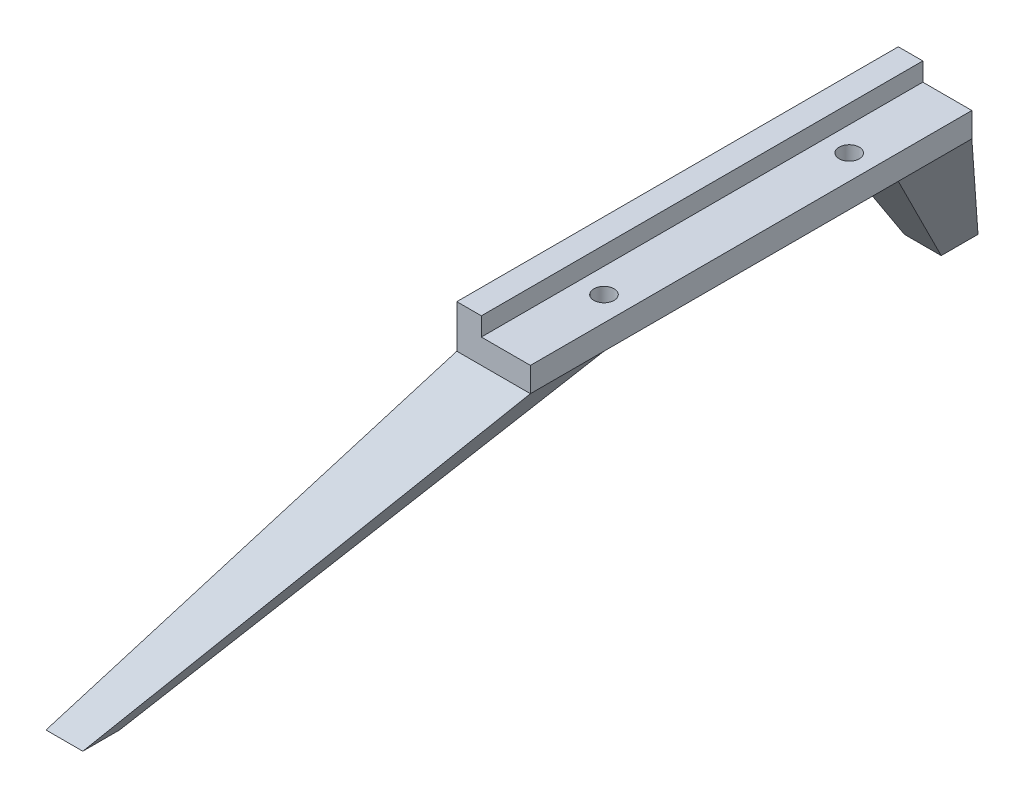
from build123d import *

# Parameters (mm, degrees)
EXTRUDE_1_DEPTH     = 36
SKETCH_2_R          = 1.65
CUT_EXTRUDE_1_DEPTH = 38.094473982


with BuildPart() as part:
    # 草图1 → 凸台-拉伸1 (new, symmetric)
    with BuildSketch(Plane.XY):
        Polygon((0, 0), (0, 3), (-4, 3), (-4, -4), (8, -4), (8, 0), align=None)
    extrude(amount=EXTRUDE_1_DEPTH, both=True)

    # 草图2 → 切除-拉伸1 (cut, through all)
    with BuildSketch(Plane(origin=(0, 0, 0), x_dir=(1, 0, 0), z_dir=(0, 1, 0))):
        with Locations(Location((4, 20, 0), (0, 0, 270))):
            Circle(SKETCH_2_R)
        with Locations(Location((4, -20, 0), (0, 0, 90))):
            Circle(SKETCH_2_R)
    extrude(amount=-CUT_EXTRUDE_1_DEPTH, mode=Mode.SUBTRACT)

    # 边界1: read off the stored shape, not the designer's step
    # 边界1: loft between two sections, ruled curve by curve
    other_1_from = [
        Edge.make_line((-34, -54, -73), (-34, -54, -67)),
        Edge.make_line((-34, -54, -67), (-28, -54, -67)),
        Edge.make_line((-28, -54, -67), (-28, -54, -73)),
        Edge.make_line((-28, -54, -73), (-34, -54, -73)),
    ]
    other_1_to = [
        Edge.make_line((-4, -4, -36), (-4, -4, -24)),
        Edge.make_line((-4, -4, -24), (8, -4, -24)),
        Edge.make_line((8, -4, -24), (8, -4, -36)),
        Edge.make_line((8, -4, -36), (-4, -4, -36)),
    ]
    other_1 = Solid(Shell([*[Face.make_surface_from_curves(other_1_from[k], other_1_to[k]) for k in range(4)], Face(Wire(other_1_from)), Face(Wire(other_1_to))]))
    add(other_1)

    # 镜向2: 边界1 across plane
    add(other_1.mirror(Plane.XY))


solid = part.part
